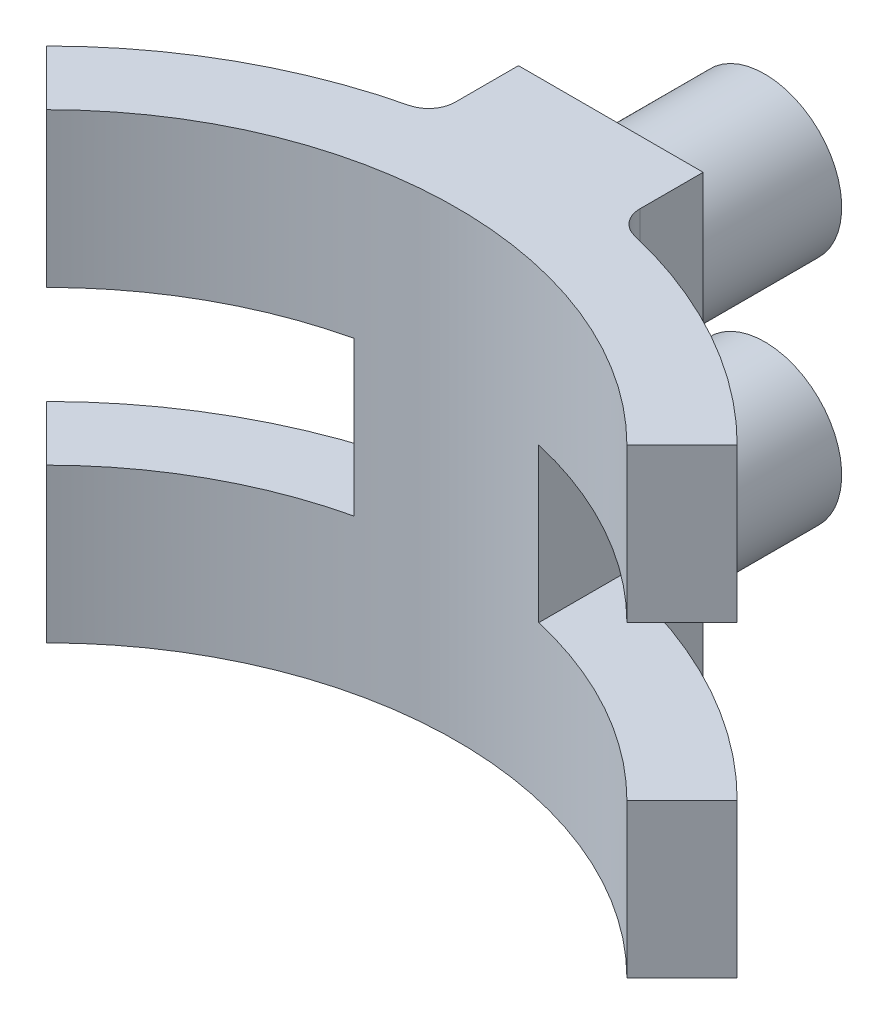
from build123d import *

# Parameters (mm, degrees)
BOSS_EXTRUDE1_DEPTH      = 75
BOSS_EXTRUDE2_START      = 225
BOSS_EXTRUDE2_DEPTH      = 75
BOSS_EXTRUDE4_REACH      = 313.111
BOSS_EXTRUDE4_END_RADIUS = 200
SKETCH4_W                = 90
SKETCH4_H                = 75
SKETCH4_6_R              = 37.5
BOSS_EXTRUDE5_DEPTH      = 75


with BuildPart() as part:
    # Sketch2 → Boss-Extrude1 (new body)
    with BuildSketch(Plane(origin=(0, 0, 0), x_dir=(1, 0, 0), z_dir=(0, 1, 0))):
        with BuildLine():
            ThreePointArc((-141.421356237, 141.421356237), (0, 200), (141.421356237, 141.421356237))
            Line((141.421356237, 141.421356237), (168.291413922, 168.291413922))
            ThreePointArc((168.291413922, 168.291413922), (116.038816401, 207.795555988), (54.996015936, 231.558714436))
            ThreePointArc((54.996015936, 231.558714436), (47.800691376, 236.146227949), (45, 244.20687951))
            Line((45, 244.20687951), (45, 275))
            Line((45, 275), (37.5, 275))
            Line((37.5, 275), (-37.5, 275))
            Line((-37.5, 275), (-45, 275))
            Line((-45, 275), (-45, 244.20687951))
            ThreePointArc((-45, 244.20687951), (-47.800691376, 236.146227949), (-54.996015936, 231.558714436))
            ThreePointArc((-54.996015936, 231.558714436), (-116.038816401, 207.795555988), (-168.291413922, 168.291413922))
            Line((-168.291413922, 168.291413922), (-141.421356237, 141.421356237))
        make_face()
    extrude(amount=BOSS_EXTRUDE1_DEPTH)



with BuildPart() as body_2:
    # Sketch2<3> → Boss-Extrude2 (new body)
    with BuildSketch(Plane(origin=(0, 0, 0), x_dir=(1, 0, 0), z_dir=(0, 1, 0)).offset(BOSS_EXTRUDE2_START)):
        with BuildLine():
            Line((141.421356237, 141.421356237), (168.291413922, 168.291413922))
            ThreePointArc((168.291413922, 168.291413922), (116.038816401, 207.795555988), (54.996015936, 231.558714436))
            ThreePointArc((54.996015936, 231.558714436), (47.800691376, 236.146227949), (45, 244.20687951))
            Line((45, 244.20687951), (45, 275))
            Line((45, 275), (-45, 275))
            Line((-45, 275), (-45, 244.20687951))
            ThreePointArc((-45, 244.20687951), (-47.800691376, 236.146227949), (-54.996015936, 231.558714436))
            ThreePointArc((-54.996015936, 231.558714436), (-116.038816401, 207.795555988), (-168.291413922, 168.291413922))
            Line((-168.291413922, 168.291413922), (-141.421356237, 141.421356237))
            ThreePointArc((-141.421356237, 141.421356237), (0, 200), (141.421356237, 141.421356237))
        make_face()
    extrude(amount=-BOSS_EXTRUDE2_DEPTH)


with BuildPart() as part_1:
    add(part.part)

    add(body_2.part)  # Boss-Extrude4 merges body 2
    # Boss-Extrude4: up to this cylinder (the profile starts outside it)
    boss_extrude4_end = Plane(origin=(0, 112.5, 0), z_dir=(0, 1, 0)) * Cylinder(BOSS_EXTRUDE4_END_RADIUS, 1027.222, mode=Mode.PRIVATE)
    # Sketch4 → Boss-Extrude4 (add, up to the surface)
    with BuildSketch(Plane(origin=(0, 0, -275), x_dir=(-1, 0, 0), z_dir=(0, 0, -1)), mode=Mode.PRIVATE) as boss_extrude4_sk1:
        with Locations((0, 112.5)):
            Rectangle(SKETCH4_W, SKETCH4_H)
    boss_extrude4_tool1 = extrude(boss_extrude4_sk1.sketch, amount=-BOSS_EXTRUDE4_REACH, mode=Mode.PRIVATE) - boss_extrude4_end
    add(boss_extrude4_tool1.solids().sort_by_distance((0, 112.5, -275))[0])

    # Sketch4<6> → Boss-Extrude5 (add)
    with BuildSketch(Plane(origin=(0, 0, -275), x_dir=(-1, 0, 0), z_dir=(0, 0, -1))):
        with Locations((0, 169)):
            Circle(SKETCH4_6_R)
        with Locations((0, 56)):
            Circle(SKETCH4_6_R)
    extrude(amount=BOSS_EXTRUDE5_DEPTH)


solid = part_1.part
